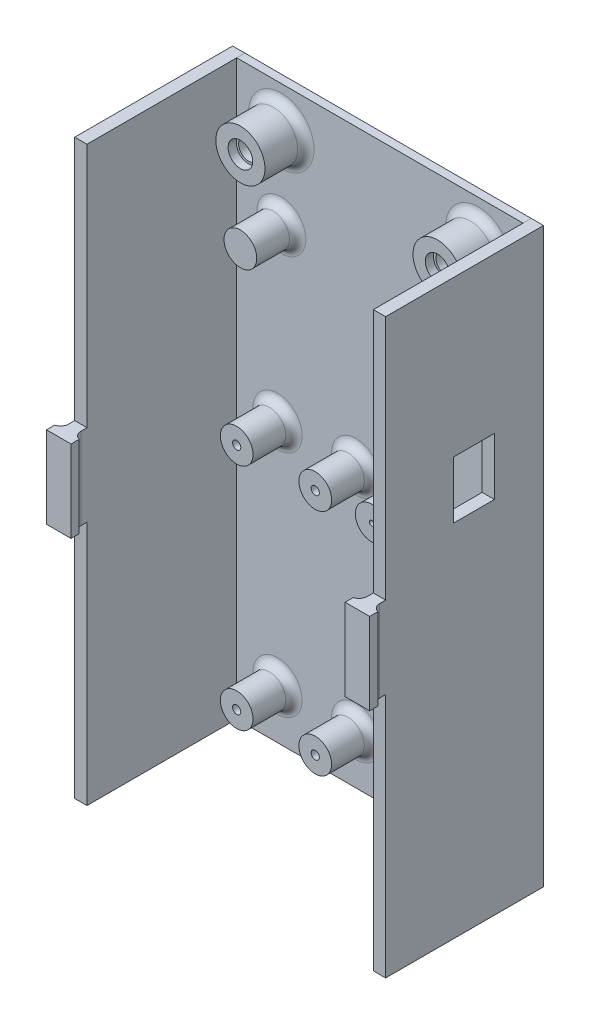
from build123d import *

# Parameters (mm, degrees)
SKICA1_W                  = 70
SKICA1_H                  = 140
P_IDAT_VYSUNUT_M1_DEPTH   = 2
SKICA2_R                  = 4
SKICA2_R_2                = 1
SKICA2_R_3                = 0.6
SKICA2_R_4                = 6
SKICA2_R_5                = 2.425
P_IDAT_VYSUNUT_M2_DEPTH   = 10
SKICA4_W                  = 3
SKICA4_H                  = 140
P_IDAT_VYSUNUT_M3_DEPTH   = 42
P_IDAT_VYSUNUT_M3_2_DEPTH = 42
SKICA5_W                  = 10
SKICA5_H                  = 14
ODEBRAT_VYSUNUT_M2_DEPTH  = 20
ZAOBLIT1_R                = 2
SKICA7_W                  = 6
SKICA7_H                  = 2
P_IDAT_VYSUNUT_M4_DEPTH   = 140
ZAOBLIT2_R                = 2
ZAOBLIT3_R                = 2
ODEBRAT_START             = -4
SKICA8_R                  = 4
ODEBRAT_VYSUNUT_M3_DEPTH  = 4
SKICA9_W                  = 18
SKICA9_H                  = 10
ODEBRAT_VYSUNUT_M4_DEPTH  = 60
SKICA10_W                 = 18
SKICA10_H                 = 10
ODEBRAT_VYSUNUT_M5_DEPTH  = 60
SKICA11_R                 = 3
ODEBRAT_VYSUNUT_M6_DEPTH  = 2


with BuildPart() as part:
    # Skica1 → Přidat vysunutím1 (new body)
    with BuildSketch(Plane.XY):
        with Locations((35, 70)):
            Rectangle(SKICA1_W, SKICA1_H)
    extrude(amount=P_IDAT_VYSUNUT_M1_DEPTH)

    # Skica2 → Přidat vysunutím2 (add)
    # profile 1 of 14: a face of its own
    with BuildSketch(Plane.XY.offset(2)):
        with Locations(Location((10, 68, 0), (0, 0, 180))):
            Circle(SKICA2_R)
        with Locations((10, 68)):
            Circle(SKICA2_R_2, mode=Mode.SUBTRACT)
    # profile 2 of 14: a face of its own
    with BuildSketch(Plane.XY.offset(2)):
        with Locations(Location((29.2, 67.999993937, 0), (0, 0, 180))):
            Circle(SKICA2_R)
        with Locations((29.2, 67.999993937)):
            Circle(SKICA2_R_2, mode=Mode.SUBTRACT)
    # profile 3 of 14: a face of its own
    with BuildSketch(Plane.XY.offset(2)):
        with Locations(Location((43, 68, 0), (0, 0, 180))):
            Circle(SKICA2_R)
        with Locations((43, 68)):
            Circle(SKICA2_R_3, mode=Mode.SUBTRACT)
    # profile 4 of 14: a face of its own
    with BuildSketch(Plane.XY.offset(2)):
        with Locations(Location((60, 68, 0), (0, 0, 180))):
            Circle(SKICA2_R)
        with Locations((60, 68)):
            Circle(SKICA2_R_3, mode=Mode.SUBTRACT)
    # profile 5 of 14: a face of its own
    with BuildSketch(Plane.XY.offset(2)):
        with Locations(Location((60, 42, 0), (0, 0, 180))):
            Circle(SKICA2_R)
        with Locations((60, 42)):
            Circle(SKICA2_R_3, mode=Mode.SUBTRACT)
    # profile 6 of 14: a face of its own
    with BuildSketch(Plane.XY.offset(2)):
        with Locations(Location((55, 30, 0), (0, 0, 180))):
            Circle(SKICA2_R)
        with Locations((55, 30)):
            Circle(SKICA2_R_3, mode=Mode.SUBTRACT)
    # profile 7 of 14: a face of its own
    with BuildSketch(Plane.XY.offset(2)):
        with Locations(Location((29.2, 11.999993937, 0), (0, 0, 180))):
            Circle(SKICA2_R)
        with Locations((29.2, 11.999993937)):
            Circle(SKICA2_R_2, mode=Mode.SUBTRACT)
    # profile 8 of 14: a face of its own
    with BuildSketch(Plane.XY.offset(2)):
        with Locations(Location((10, 12, 0), (0, 0, 180))):
            Circle(SKICA2_R)
        with Locations((10, 12)):
            Circle(SKICA2_R_2, mode=Mode.SUBTRACT)
    # profile 9 of 14: a face of its own
    with BuildSketch(Plane.XY.offset(2)):
        with Locations(Location((10.9, 130, 0), (0, 0, 180))):
            Circle(SKICA2_R_4)
        with Locations((10.9, 130)):
            Circle(SKICA2_R_5, mode=Mode.SUBTRACT)
    # profile 10 of 14: a face of its own
    with BuildSketch(Plane.XY.offset(2)):
        with Locations(Location((59.1, 129.999993937, 0), (0, 0, 180))):
            Circle(SKICA2_R_4)
        with Locations((59.1, 129.999993937)):
            Circle(SKICA2_R_5, mode=Mode.SUBTRACT)
    # profile 11 of 14: a face of its own
    with BuildSketch(Plane.XY.offset(2)):
        with Locations(Location((43, 42, 0), (0, 0, 180))):
            Circle(SKICA2_R)
        with Locations((43, 42)):
            Circle(SKICA2_R_3, mode=Mode.SUBTRACT)
    # profile 12 of 14: a face of its own
    with BuildSketch(Plane.XY.offset(2)):
        with Locations(Location((10.9, 110, 0), (0, 0, 180))):
            Circle(SKICA2_R)
    # profile 13 of 14: a face of its own
    with BuildSketch(Plane.XY.offset(2)):
        with Locations(Location((59.1, 109.999993937, 0), (0, 0, 180))):
            Circle(SKICA2_R)
    # profile 14 of 14: a face of its own
    with BuildSketch(Plane.XY.offset(2)):
        with Locations(Location((60, 14, 0), (0, 0, 180))):
            Circle(SKICA2_R)
    extrude(amount=P_IDAT_VYSUNUT_M2_DEPTH)

    # Zaoblit1
    zaoblit1_edges = [part.edges().sort_by_distance(p)[0] for p in [
        (14, 68, 2),
        (33.2, 67.999993937, 2),
        (47, 68, 2),
        (64, 68, 2),
        (64, 42, 2),
        (59, 30, 2),
        (33.2, 11.999993937, 2),
        (14, 12, 2),
        (16.9, 130, 2),
        (65.1, 129.999993937, 2),
        (47, 42, 2),
        (14.9, 110, 2),
        (63.1, 109.999993937, 2),
        (64, 14, 2),
    ]]
    fillet(zaoblit1_edges, radius=ZAOBLIT1_R)

    # Skica8 → Odebrat vysunutím3 (cut)
    with BuildSketch(Plane.XY.offset(12).offset(ODEBRAT_START)):
        with Locations(Location((55, 30, 0), (0, 0, 180))):
            Circle(SKICA8_R)
        with Locations(Location((60, 14, 0), (0, 0, 180))):
            Circle(SKICA8_R)
    extrude(amount=ODEBRAT_VYSUNUT_M3_DEPTH, mode=Mode.SUBTRACT)

    # Skica11 → Odebrat vysunutím6 (cut)
    with BuildSketch(Plane.XY.offset(12)):
        with Locations((10.9, 130)):
            Circle(SKICA11_R)
        with Locations((59.1, 129.999993937)):
            Circle(SKICA11_R)
    extrude(amount=-ODEBRAT_VYSUNUT_M6_DEPTH, mode=Mode.SUBTRACT)


with BuildPart() as body_2:
    # Skica4 → Přidat vysunutím3 (new body)
    with BuildSketch(Plane.XY):
        with Locations((-1.5, 70)):
            Rectangle(SKICA4_W, SKICA4_H)
    extrude(amount=P_IDAT_VYSUNUT_M3_DEPTH)



with BuildPart() as body_3:
    # Skica4 → P_idat vysunut_m3 2 (new body)
    with BuildSketch(Plane.XY):
        with Locations((71.5, 70)):
            Rectangle(SKICA4_W, SKICA4_H)
    extrude(amount=P_IDAT_VYSUNUT_M3_2_DEPTH)

    # Skica5 → Odebrat vysunutím2 (cut)
    with BuildSketch(Plane(origin=(73, 0, 0), x_dir=(0, 0, -1), z_dir=(1, 0, 0))):
        with Locations((-17, 95)):
            Rectangle(SKICA5_W, SKICA5_H)
    extrude(amount=-ODEBRAT_VYSUNUT_M2_DEPTH, mode=Mode.SUBTRACT)


with BuildPart() as body_2_1:
    add(body_2.part)

    add(body_3.part)  # Přidat vysunutím4 merges body 3
    # Skica7 → Přidat vysunutím4 (add)
    with BuildSketch(Plane.XZ):
        with Locations((-1.5, 43)):
            Rectangle(SKICA7_W, SKICA7_H)
        with Locations((71.5, 43)):
            Rectangle(SKICA7_W, SKICA7_H)
    extrude(amount=-P_IDAT_VYSUNUT_M4_DEPTH)

    # Zaoblit2
    # the kernel refuses this fillet: 2 mm, written as the material it adds along each edge
    with BuildSketch(Plane(origin=(-3, 0, 42), x_dir=(-1, 0, 0), z_dir=(0, 1, 0)), Plane(origin=(0, 140, 42), x_dir=(1, 0, 0), z_dir=(0, -1, 0))) as zaoblit2_piece_1:
        with BuildLine():
            CenterArc((2, -1.936491673), ZAOBLIT2_R, 104.477512186, 75.522487814)
            Line((0, -1.936491673), (-0.04, -1.936491673))
            Line((-0.04, -1.936491673), (-0.04, 0))
            Line((-0.04, 0), (0, 0.04))
            ThreePointArc((0, 0.04), (0.75, 0.04), (1.49, 0.038729833))
            Line((1.49, 0.038729833), (1.5, 0))
        make_face()
    extrude(amount=140)

    # Zaoblit3
    # the kernel refuses this fillet: 2 mm, written as the material it adds along each edge
    with BuildSketch(Plane(origin=(73, 0, 42), x_dir=(1, 0, 0), z_dir=(0, 1, 0)), Plane(origin=(70, 140, 42), x_dir=(-1, 0, 0), z_dir=(0, -1, 0))) as zaoblit3_piece_1:
        with BuildLine():
            CenterArc((2, 1.936491673), ZAOBLIT3_R, 180, 75.522487814)
            Line((0, 1.936491673), (-0.04, 1.936491673))
            Line((-0.04, 1.936491673), (-0.04, 0))
            Line((-0.04, 0), (0, -0.04))
            ThreePointArc((0, -0.04), (0.75, -0.04), (1.49, -0.038729833))
            Line((1.49, -0.038729833), (1.5, 0))
        make_face()
    extrude(amount=140)

    # Skica9 → Odebrat vysunutím4 (cut)
    with BuildSketch(Plane.XZ):
        with Locations((-1.063409624, 43.6)):
            Rectangle(SKICA9_W, SKICA9_H)
        with Locations((71.06, 43.6)):
            Rectangle(SKICA9_W, SKICA9_H)
    extrude(amount=-ODEBRAT_VYSUNUT_M4_DEPTH, mode=Mode.SUBTRACT)

    # Skica10 → Odebrat vysunutím5 (cut)
    with BuildSketch(Plane(origin=(0, 140, 0), x_dir=(1, 0, 0), z_dir=(0, 1, 0))):
        with Locations((-1.06, -43.6)):
            Rectangle(SKICA10_W, SKICA10_H)
        with Locations((71.06, -43.6)):
            Rectangle(SKICA10_W, SKICA10_H)
    extrude(amount=-ODEBRAT_VYSUNUT_M5_DEPTH, mode=Mode.SUBTRACT)


solid = Compound([part.part, body_2_1.part])
